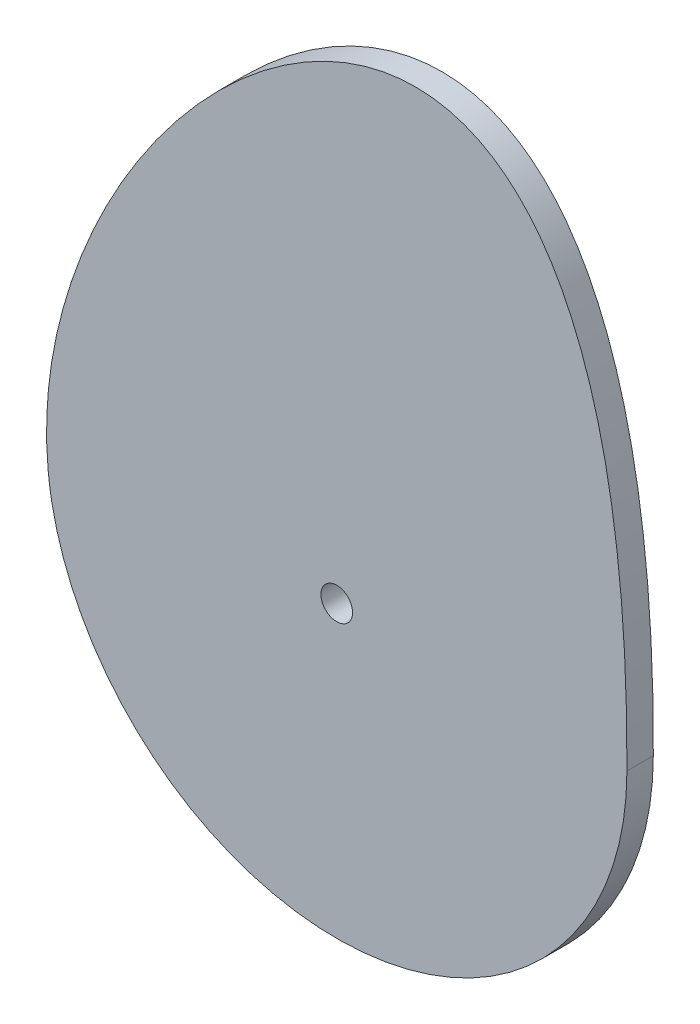
from build123d import *

# Parameters (mm, degrees)
SKETCH1_R           = 3
BOSS_EXTRUDE1_DEPTH = 5


with BuildPart() as part:
    # Sketch1 → Boss-Extrude1 (new body)
    with BuildSketch(Plane.XY):
        with BuildLine():
            ThreePointArc((-54.044325591, -10.208372612), (5.12650429, -54.760560203), (55, 0))
            add(Edge.make_bspline(
                [(55, 0), (55.84387333, 174.424602778), (-67.019956604, 60.843883098), (-54.044325591, -10.208372612)],
                knots=[0, 0, 0, 0, 1, 1, 1, 1], degree=3))
        make_face()
        Circle(SKETCH1_R, mode=Mode.SUBTRACT)
    extrude(amount=BOSS_EXTRUDE1_DEPTH)


solid = part.part
